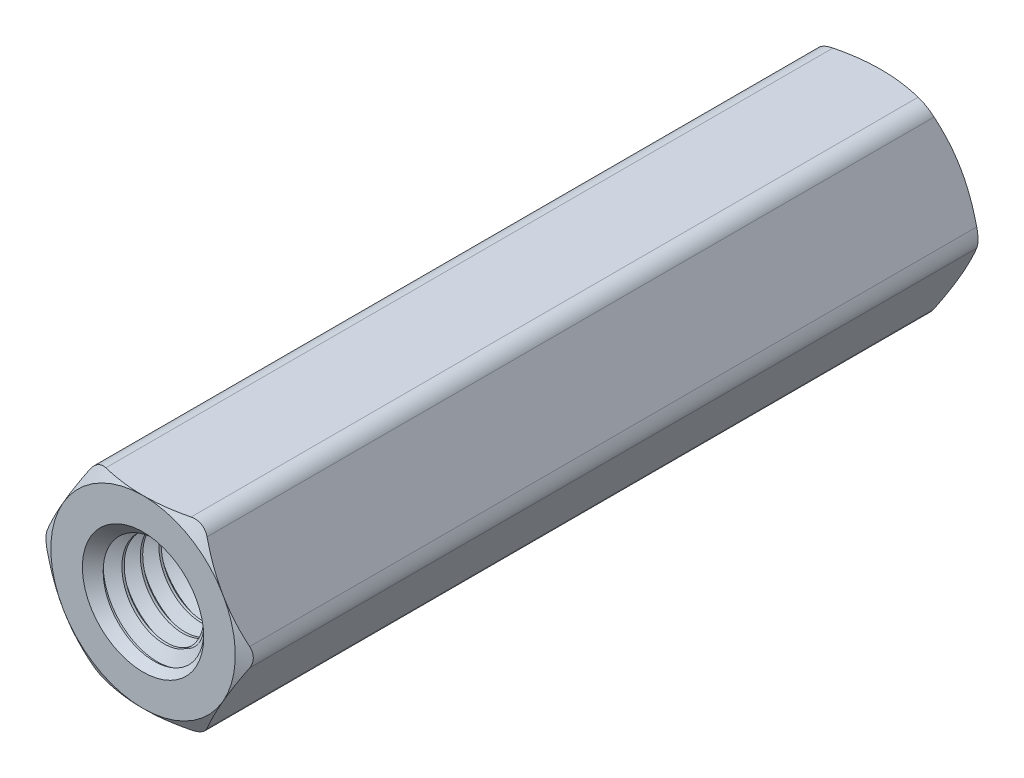
from build123d import *

# Parameters (mm, degrees)
SKETCH4_R           = 3.190875
BOSS_EXTRUDE1_DEPTH = 15.875
SKETCH5_OUTSIDE_W   = 133.4
SKETCH5_OUTSIDE_H   = 132.172
SKETCH5_OUTSIDE_R   = 3.96875
CUT_EXTRUDE1_DEPTH  = 33.323594767
CUT_EXTRUDE1_DRAFT  = -60
SKETCH6_OUTSIDE_W   = 133.4
SKETCH6_OUTSIDE_H   = 132.172
SKETCH6_OUTSIDE_R   = 3.96875
CUT_EXTRUDE2_DEPTH  = 33.323594767
CUT_EXTRUDE2_DRAFT  = -60
FILLET1_R           = 0.79375
BOSS_EXTRUDE2_START = -12.7
SKETCH7_R           = 2.6114375
BOSS_EXTRUDE2_DEPTH = 12.7
SKETCH8_W           = 12.7
SKETCH8_H           = 2.413
CUT_SWEEP1_PITCH    = 0.79375
CUT_SWEEP1_TO       = 12.7
CIRPATTERN1_COUNT   = 2


with BuildPart() as part:
    # Sketch3 → Revolve1 (revolve)
    with BuildSketch(Plane(origin=(0, 0, 0), x_dir=(0, 0, -1), z_dir=(1, 0, 0))):
        Polygon((-15.6765625, 2.413), (-3.175, 2.413), (-3.175, 0), (3.175, 0), (3.175, 2.413), (15.875, 2.413), (15.875, 3.96875), (0, 3.96875), (-15.875, 3.96875), (-15.875, 2.6114375), align=None)
        Polygon((-15.6765625, 2.413), (-3.175, 2.413), (-3.175, 0), (3.175, 0), (3.175, 2.413), (15.875, 2.413), (15.875, 3.96875), (0, 3.96875), (-15.875, 3.96875), (-15.875, 2.6114375), align=None)
    revolve(axis=Axis((0, 0, 3.175), (0, 0, 1)))

    # Sketch4 → Boss-Extrude1 (add, symmetric)
    with BuildSketch(Plane.XY):
        Polygon((-2.291358881, 3.96875), (-4.582717762, 0), (-2.291358881, -3.96875), (2.291358881, -3.96875), (4.582717762, 0), (2.291358881, 3.96875), align=None)
        Circle(SKETCH4_R, mode=Mode.SUBTRACT)
    extrude(amount=BOSS_EXTRUDE1_DEPTH, both=True)


with BuildPart() as cut_extrude1_tool:
    # Sketch5 outside → Cut-Extrude1 (with draft: the straight prism first)
    with BuildSketch(Plane.XY.offset(15.875)):
        Rectangle(SKETCH5_OUTSIDE_W, SKETCH5_OUTSIDE_H)
        Circle(SKETCH5_OUTSIDE_R, mode=Mode.SUBTRACT)
    extrude(amount=-CUT_EXTRUDE1_DEPTH)
    # Cut-Extrude1: the draft: its side faces are tilted about the plane it starts from
    cut_extrude1_sides = [cut_extrude1_tool.faces().sort_by_distance(p)[0] for p in [
        (0, -66.086, -0.786797383),
        (66.7, 0, -0.786797383),
        (0, 66.086, -0.786797383),
        (-66.7, 0, -0.786797383),
        (-3.96875, 0, -0.786797383),
    ]]
    draft(cut_extrude1_sides, Plane.XY.offset(15.875), CUT_EXTRUDE1_DRAFT)


with BuildPart() as part_1:
    add(part.part)

    # Cut-Extrude1: cut by cut_extrude1_tool
    add(cut_extrude1_tool.part, mode=Mode.SUBTRACT)


with BuildPart() as cut_extrude2_tool:
    # Sketch6 outside → Cut-Extrude2 (with draft: the straight prism first)
    with BuildSketch(Plane(origin=(0, 0, -15.875), x_dir=(-1, 0, 0), z_dir=(0, 0, -1))):
        Rectangle(SKETCH6_OUTSIDE_W, SKETCH6_OUTSIDE_H)
        Circle(SKETCH6_OUTSIDE_R, mode=Mode.SUBTRACT)
    extrude(amount=-CUT_EXTRUDE2_DEPTH)
    # Cut-Extrude2: the draft: its side faces are tilted about the plane it starts from
    cut_extrude2_sides = [cut_extrude2_tool.faces().sort_by_distance(p)[0] for p in [
        (0, -66.086, 0.786797383),
        (-66.7, 0, 0.786797383),
        (0, 66.086, 0.786797383),
        (66.7, 0, 0.786797383),
        (3.96875, 0, 0.786797383),
    ]]
    draft(cut_extrude2_sides, Plane(origin=(0, 0, -15.875), x_dir=(-1, 0, 0), z_dir=(0, 0, -1)), CUT_EXTRUDE2_DRAFT)


with BuildPart() as part_2:
    add(part_1.part)

    # Cut-Extrude2: cut by cut_extrude2_tool
    add(cut_extrude2_tool.part, mode=Mode.SUBTRACT)

    # Fillet1
    fillet1_edges = [part_2.edges().sort_by_distance(p)[0] for p in [
        (2.291358881, 3.96875, 0),
        (-4.582717762, 0, 0),
        (-2.291358881, -3.96875, 0),
        (2.291358881, -3.96875, 0),
        (4.582717762, 0, 0),
        (-2.291358881, 3.96875, 0),
    ]]
    fillet(fillet1_edges, radius=FILLET1_R)

    # Split1
    split(bisect_by=Plane.XY, keep=Keep.TOP)

    # Sketch7 → Boss-Extrude2 (add)
    with BuildSketch(Plane(origin=(0, 0, 3.175), x_dir=(-1, 0, 0), z_dir=(0, 0, -1)).offset(BOSS_EXTRUDE2_START)):
        Circle(SKETCH7_R)
    extrude(amount=BOSS_EXTRUDE2_DEPTH)


with BuildPart() as body_2:
    # Sketch8 → Revolve2 (revolve)
    with BuildSketch(Plane(origin=(0, 0, 0), x_dir=(0, 0, -1), z_dir=(1, 0, 0))):
        with Locations((-9.525, 1.2065)):
            Rectangle(SKETCH8_W, SKETCH8_H)
    revolve(axis=Axis((0, 0, 3.175), (0, 0, 1)))

    # Cut-Sweep1: arcs per turn and ends read off the stored shape
    # Cut-Sweep1: the profile of Sketch10 screwed along a right-hand helix through 18 turns, 8 arcs to a turn; built about Z, then put on its axis
    cut_sweep1_z = Axis((0, 0, 0), (0, 0, 1))
    cut_sweep1_corners = [(1.897444252, 0, -1.190625), (1.897444252, 0, -1.09140625), (2.455962979, 0, -0.768945313), (2.455962979, 0, -1.513085938)]
    with BuildLine(mode=Mode.PRIVATE) as cut_sweep1_profile:
        Line(cut_sweep1_corners[0], cut_sweep1_corners[1])
        Line(cut_sweep1_corners[1], cut_sweep1_corners[2])
        Line(cut_sweep1_corners[2], cut_sweep1_corners[3])
        Line(cut_sweep1_corners[3], cut_sweep1_corners[0])
    cut_sweep1_cap = Face(cut_sweep1_profile.wire())
    cut_sweep1_turn_angles = [0, 22.5, 45, 67.5, 90, 112.5, 135, 157.5, 180, 202.5, 225, 247.5, 270, 292.5, 315, 337.5, 360]
    cut_sweep1_turn_weights = [1, 0.9238795325112867, 1, 0.9238795325112867, 1, 0.9238795325112867, 1, 0.9238795325112867, 1, 0.9238795325112867, 1, 0.9238795325112867, 1, 0.9238795325112867, 1, 0.9238795325112867, 1]
    cut_sweep1_turn_rails = [Edge.make_bspline([Vector(p[0], p[1], 0).rotate(cut_sweep1_z, cut_sweep1_turn_angles[k]) / cut_sweep1_turn_weights[k] + Vector(0, 0, p[2] + CUT_SWEEP1_PITCH * cut_sweep1_turn_angles[k] / 360) for k in range(17)], [0, 0, 0, 1, 1, 2, 2, 3, 3, 4, 4, 5, 5, 6, 6, 7, 7, 8, 8, 8], 2, cut_sweep1_turn_weights) for p in cut_sweep1_corners]
    cut_sweep1_turn_sides = [Face.make_surface_from_curves(cut_sweep1_turn_rails[p[0]], cut_sweep1_turn_rails[p[1]]) for p in [(0, 1), (1, 2), (2, 3), (3, 0)]]
    cut_sweep1 = Plane(origin=(0, 0, 15.875), x_dir=(0, 1, 0), z_dir=(0, 0, -1)) * split(Solid(Shell([*[p.moved(Location((0, 0, CUT_SWEEP1_PITCH * i))) for i in range(18) for p in cut_sweep1_turn_sides], cut_sweep1_cap, cut_sweep1_cap.rotate(cut_sweep1_z, 6480).moved(Location((0, 0, CUT_SWEEP1_PITCH * 6480 / 360)))])), bisect_by=Plane.XY.offset(CUT_SWEEP1_TO), keep=Keep.BOTTOM, mode=Mode.PRIVATE)
    add(cut_sweep1, mode=Mode.SUBTRACT)


with BuildPart() as part_3:
    add(part_2.part)

    # Combine1: cut body 2
    add(body_2.part, mode=Mode.SUBTRACT)

    # Cut-Extrude3 cone 1 section (through the dimple's axis) → Cut-Extrude3 (revolve, cut)
    with BuildSketch(Plane(origin=(0, 0, 15.875), x_dir=(0, -1, 0), z_dir=(1, 0, 0))):
        Polygon((0, 0), (2.6114375, 0), (0, 2.6114375), align=None)
    revolve(axis=Axis((0, 0, 15.875), (0, 0, -1)), mode=Mode.SUBTRACT)


with BuildPart() as cirpattern1_1:
    # CirPattern1: pattern copy
    add(part_3.part.rotate(Axis((0, 0, 0), (1, 0, 0)), 1 * 360 / CIRPATTERN1_COUNT))


with BuildPart() as part_4:
    add(part_3.part)

    # Combine2: union CirPattern1_1
    add(cirpattern1_1.part)


solid = part_4.part
